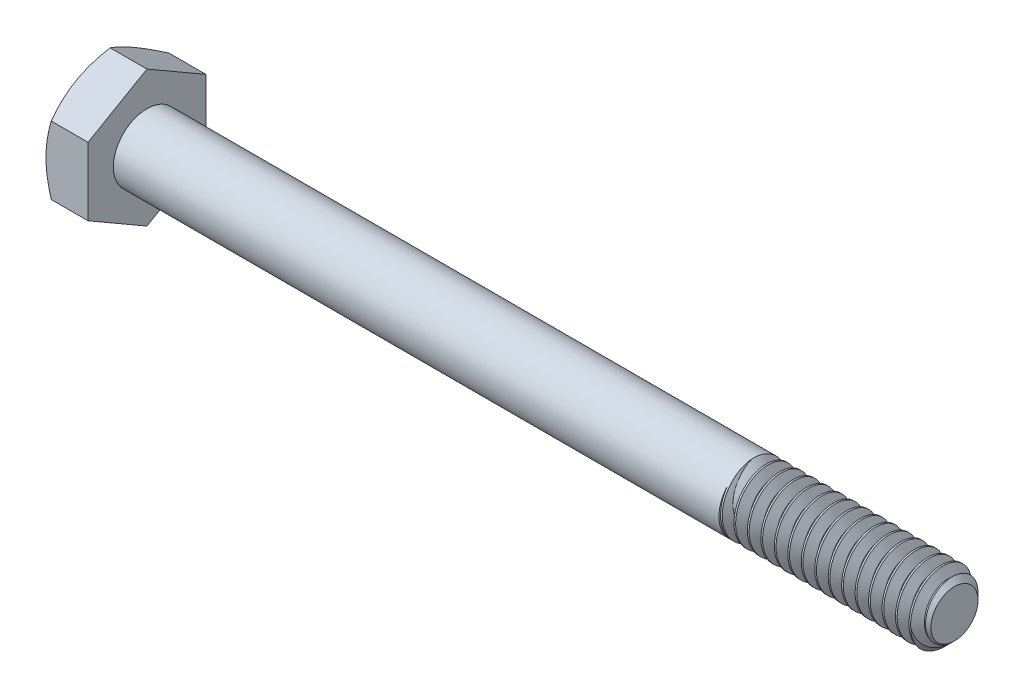
from build123d import *

# Parameters (mm, degrees)
SKETCH5_R           = 3.175
BOSS_EXTRUDE3_DEPTH = 76.2
CHAMFER1_SIZE       = 0.9525
CUT_SWEEP1_PITCH    = 1.27
BOSS_EXTRUDE4_DEPTH = 3.96875
SKETCH8_OUTSIDE_W   = 312.23
SKETCH8_OUTSIDE_H   = 313.95
SKETCH8_OUTSIDE_R   = 5.55625
CUT_EXTRUDE3_DEPTH  = 81.61676599
CUT_EXTRUDE3_DRAFT  = -60


with BuildPart() as part:
    # Sketch5 → Boss-Extrude3 (new body)
    with BuildSketch(Plane(origin=(40.084375, 0, 0), x_dir=(0, 0, -1), z_dir=(1, 0, 0))):
        Circle(SKETCH5_R)
    extrude(amount=-BOSS_EXTRUDE3_DEPTH)

    # Chamfer1
    chamfer1_edges = [part.edges().sort_by_distance(p)[0] for p in [
        (40.084375, 0, 3.175),
    ]]
    chamfer(chamfer1_edges, length=CHAMFER1_SIZE)

    # Cut-Sweep1: the profile of Sketch10 profile screwed along a right-hand helix of 16 turns, 8 arcs to a turn; built about Z, then put on its axis
    cut_sweep1_z = Axis((0, 0, 0), (0, 0, 1))
    cut_sweep1_corners = [(3.1753, 0, 0.000173205), (2.350110803, 0, -0.47625), (2.350110803, 0, -0.635), (3.1753, 0, -1.111423205)]
    with BuildLine(mode=Mode.PRIVATE) as cut_sweep1_profile:
        Line(cut_sweep1_corners[0], cut_sweep1_corners[1])
        Line(cut_sweep1_corners[1], cut_sweep1_corners[2])
        Line(cut_sweep1_corners[2], cut_sweep1_corners[3])
        Line(cut_sweep1_corners[3], cut_sweep1_corners[0])
    cut_sweep1_cap = Face(cut_sweep1_profile.wire())
    cut_sweep1_turn_angles = [0, 22.5, 45, 67.5, 90, 112.5, 135, 157.5, 180, 202.5, 225, 247.5, 270, 292.5, 315, 337.5, 360]
    cut_sweep1_turn_weights = [1, 0.9238795325112867, 1, 0.9238795325112867, 1, 0.9238795325112867, 1, 0.9238795325112867, 1, 0.9238795325112867, 1, 0.9238795325112867, 1, 0.9238795325112867, 1, 0.9238795325112867, 1]
    cut_sweep1_turn_rails = [Edge.make_bspline([Vector(p[0], p[1], 0).rotate(cut_sweep1_z, cut_sweep1_turn_angles[k]) / cut_sweep1_turn_weights[k] + Vector(0, 0, p[2] + CUT_SWEEP1_PITCH * cut_sweep1_turn_angles[k] / 360) for k in range(17)], [0, 0, 0, 1, 1, 2, 2, 3, 3, 4, 4, 5, 5, 6, 6, 7, 7, 8, 8, 8], 2, cut_sweep1_turn_weights) for p in cut_sweep1_corners]
    cut_sweep1_turn_sides = [Face.make_surface_from_curves(cut_sweep1_turn_rails[p[0]], cut_sweep1_turn_rails[p[1]]) for p in [(0, 1), (1, 2), (2, 3), (3, 0)]]
    cut_sweep1 = Plane(origin=(40.084375, 0, 0), x_dir=(0, 1, 0), z_dir=(-1, 0, 0)) * Solid(Shell([*[p.moved(Location((0, 0, CUT_SWEEP1_PITCH * i))) for i in range(16) for p in cut_sweep1_turn_sides], cut_sweep1_cap, cut_sweep1_cap.rotate(cut_sweep1_z, 5760).moved(Location((0, 0, CUT_SWEEP1_PITCH * 5760 / 360)))]))
    add(cut_sweep1, mode=Mode.SUBTRACT)

    # Sketch11 → Revolve1 (revolve)
    with BuildSketch(Plane.XY, mode=Mode.PRIVATE) as revolve1_sk:
        Polygon((-36.115625, 3.175), (-36.115625, 0), (24.209375, 0), (21.034375, 3.175), align=None)
    revolve(revolve1_sk.sketch.rotate(Axis((-36.115625, 0, 0), (1, 0, 0)), 270), axis=Axis((-36.115625, 0, 0), (1, 0, 0)))

    # Sketch6 → Boss-Extrude4 (add)
    with BuildSketch(Plane.ZY.offset(36.115625)):
        Polygon((5.55625, 3.207902433), (0, 6.415804866), (-5.55625, 3.207902433), (-5.55625, -3.207902433), (0, -6.415804866), (5.55625, -3.207902433), align=None)
    extrude(amount=BOSS_EXTRUDE4_DEPTH)


with BuildPart() as cut_extrude3_tool:
    # Sketch8 outside → Cut-Extrude3 (with draft: the straight prism first)
    with BuildSketch(Plane.ZY.offset(40.084375)):
        Rectangle(SKETCH8_OUTSIDE_W, SKETCH8_OUTSIDE_H)
        Circle(SKETCH8_OUTSIDE_R, mode=Mode.SUBTRACT)
    extrude(amount=-CUT_EXTRUDE3_DEPTH)
    # Cut-Extrude3: the draft: its side faces are tilted about the plane it starts from
    cut_extrude3_sides = [cut_extrude3_tool.faces().sort_by_distance(p)[0] for p in [
        (0.724007995, -156.975, 0),
        (0.724007995, 0, 156.115),
        (0.724007995, 156.975, 0),
        (0.724007995, 0, -156.115),
        (0.724007995, 0, -5.55625),
    ]]
    draft(cut_extrude3_sides, Plane.ZY.offset(40.084375), CUT_EXTRUDE3_DRAFT)


with BuildPart() as part_1:
    add(part.part)

    # Cut-Extrude3: cut by cut_extrude3_tool
    add(cut_extrude3_tool.part, mode=Mode.SUBTRACT)


solid = part_1.part
